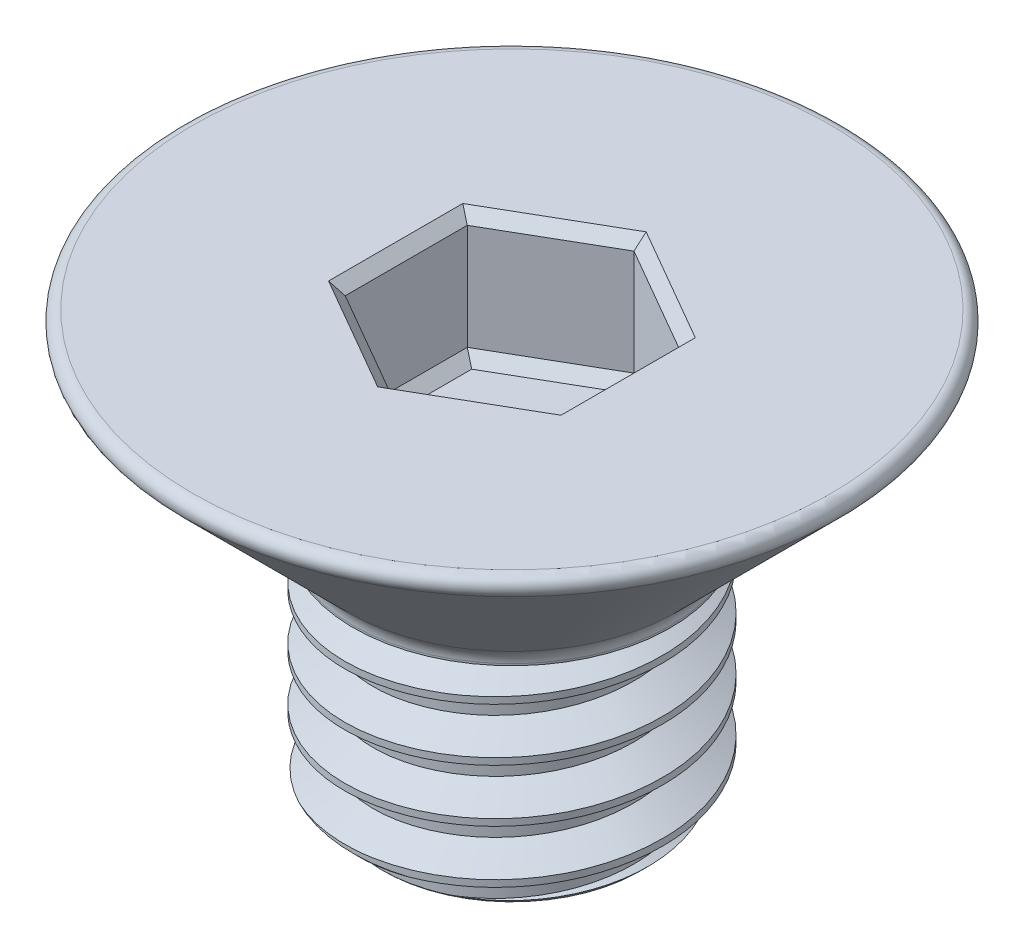
from build123d import *

# Parameters (mm, degrees)
SKETCH1_R           = 1.5
BOSS_EXTRUDE1_DEPTH = 2.14
THREAD1_PITCH       = 0.5
SKETCH5_R           = 1.5
BOSS_EXTRUDE2_DEPTH = 0.1
SKETCH6_R           = 1.5
BOSS_EXTRUDE3_DEPTH = 1.76
BOSS_EXTRUDE3_DRAFT = -45
FILLET1_R           = 0.1
FILLET2_R           = 0.2
CUT_EXTRUDE1_DEPTH  = 1.1
CHAMFER1_SIZE       = 0.1
CUT_EXTRUDE2_DEPTH  = 0.1
CUT_EXTRUDE2_DRAFT  = -45


with BuildPart() as part:
    # Sketch1 → Boss-Extrude1 (new body)
    with BuildSketch(Plane(origin=(0, 0, 0), x_dir=(1, 0, 0), z_dir=(0, 1, 0))):
        with Locations(Location((0, 0, 0), (0, 0, 270))):
            Circle(SKETCH1_R)
    extrude(amount=BOSS_EXTRUDE1_DEPTH)

    # Thread1: the profile of Thread Profile1 profile screwed along a right-hand helix of 6.28 turns, 6 arcs to a turn; built about Z, then put on its axis
    thread1_z = Axis((0, 0, 0), (0, 0, 1))
    thread1_corners = [(1.5003, 0, -0.000173205), (1.5003, 0, 0.437673204), (1.229367063, 0, 0.281249999), (1.229367063, 0, 0.156249999)]
    with BuildLine(mode=Mode.PRIVATE) as thread1_profile:
        Line(thread1_corners[0], thread1_corners[1])
        Line(thread1_corners[1], thread1_corners[2])
        Line(thread1_corners[2], thread1_corners[3])
        Line(thread1_corners[3], thread1_corners[0])
    thread1_cap = Face(thread1_profile.wire())
    thread1_turn_angles = [0, 30, 60, 90, 120, 150, 180, 210, 240, 270, 300, 330, 360]
    thread1_turn_weights = [1, 0.8660254037844387, 1, 0.8660254037844387, 1, 0.8660254037844387, 1, 0.8660254037844387, 1, 0.8660254037844387, 1, 0.8660254037844387, 1]
    thread1_turn_rails = [Edge.make_bspline([Vector(p[0], p[1], 0).rotate(thread1_z, thread1_turn_angles[k]) / thread1_turn_weights[k] + Vector(0, 0, p[2] + THREAD1_PITCH * thread1_turn_angles[k] / 360) for k in range(13)], [0, 0, 0, 1, 1, 2, 2, 3, 3, 4, 4, 5, 5, 6, 6, 6], 2, thread1_turn_weights) for p in thread1_corners]
    thread1_turn_sides = [Face.make_surface_from_curves(thread1_turn_rails[p[0]], thread1_turn_rails[p[1]]) for p in [(0, 1), (1, 2), (2, 3), (3, 0)]]
    thread1_last_angles = [2160, 2190, 2220, 2240.4, 2260.8]
    thread1_last_weights = [1, 0.8660254037844387, 1, 0.9372819894918923, 1]
    thread1_last_rails = [Edge.make_bspline([Vector(p[0], p[1], 0).rotate(thread1_z, thread1_last_angles[k]) / thread1_last_weights[k] + Vector(0, 0, p[2] + THREAD1_PITCH * thread1_last_angles[k] / 360) for k in range(5)], [0, 0, 0, 1, 1, 2, 2, 2], 2, thread1_last_weights) for p in thread1_corners]
    thread1_last_sides = [Face.make_surface_from_curves(thread1_last_rails[p[0]], thread1_last_rails[p[1]]) for p in [(0, 1), (1, 2), (2, 3), (3, 0)]]
    thread1 = Plane(origin=(0, 3.14, 0), x_dir=(-1, 0, 0), z_dir=(0, -1, 0)) * Solid(Shell([*[p.moved(Location((0, 0, THREAD1_PITCH * i))) for i in range(6) for p in thread1_turn_sides], *thread1_last_sides, thread1_cap, thread1_cap.rotate(thread1_z, 2260.8).moved(Location((0, 0, THREAD1_PITCH * 2260.8 / 360)))]))
    add(thread1, mode=Mode.SUBTRACT)

    # Sketch5 → Boss-Extrude2 (add)
    with BuildSketch(Plane(origin=(0, 2.14, 0), x_dir=(1, 0, 0), z_dir=(0, 1, 0))):
        with Locations(Location((0, 0, 0), (0, 0, 79.630240195))):
            Circle(SKETCH5_R)
    extrude(amount=BOSS_EXTRUDE2_DEPTH)


with BuildPart() as boss_extrude3_tool:
    # Sketch6 → Boss-Extrude3 (with draft: the straight prism first)
    with BuildSketch(Plane(origin=(0, 2.24, 0), x_dir=(1, 0, 0), z_dir=(0, 1, 0))):
        with Locations(Location((0, 0, 0), (0, 0, 79.630240195))):
            Circle(SKETCH6_R)
    extrude(amount=BOSS_EXTRUDE3_DEPTH)
    # Boss-Extrude3: the draft: its side faces are tilted about the plane it starts from
    boss_extrude3_sides = [boss_extrude3_tool.faces().sort_by_distance(p)[0] for p in [
        (-0.27, 3.12, 1.475499915),
    ]]
    draft(boss_extrude3_sides, Plane(origin=(0, 2.24, 0), x_dir=(1, 0, 0), z_dir=(0, 1, 0)), BOSS_EXTRUDE3_DRAFT)


with BuildPart() as part_1:
    add(part.part)

    # Boss-Extrude3: add boss_extrude3_tool
    add(boss_extrude3_tool.part)

    # Sketch7 → Cut-Revolve1 (revolve, cut)
    with BuildSketch(Plane.XY, mode=Mode.PRIVATE) as cut_revolve1_sk:
        Polygon((1.51, 0), (1.51, 0.3), (1.21, 0), align=None)
    revolve(cut_revolve1_sk.sketch.rotate(Axis((0, 0, 0), (0, 1, 0)), 135.522486844), axis=Axis((0, 0, 0), (0, 1, 0)), mode=Mode.SUBTRACT)

    # Fillet1
    fillet1_edges = [part_1.edges().sort_by_distance(p)[0] for p in [
        (-0.5868, 4, 3.206753149),
    ]]
    fillet(fillet1_edges, radius=FILLET1_R)

    # Fillet2
    fillet2_edges = [part_1.edges().sort_by_distance(p)[0] for p in [
        (-0.27, 2.24, 1.475499915),
    ]]
    fillet(fillet2_edges, radius=FILLET2_R)

    # Sketch8 → Cut-Extrude1 (cut)
    with BuildSketch(Plane(origin=(0, 4, 0), x_dir=(1, 0, 0), z_dir=(0, 1, 0))):
        Polygon((0, 1.154700538), (-1, 0.577350269), (-1, -0.577350269), (0, -1.154700538), (1, -0.577350269), (1, 0.577350269), align=None)
    extrude(amount=-CUT_EXTRUDE1_DEPTH, mode=Mode.SUBTRACT)

    # Chamfer1
    chamfer1_edges = [part_1.edges().sort_by_distance(p)[0] for p in [
        (0.5, 4, -0.866025404),
        (-0.5, 4, -0.866025404),
        (-1, 4, 0),
        (-0.5, 4, 0.866025404),
        (0.5, 4, 0.866025404),
        (1, 4, 0),
    ]]
    chamfer(chamfer1_edges, length=CHAMFER1_SIZE)


with BuildPart() as cut_extrude2_tool:
    # Sketch9 → Cut-Extrude2 (with draft: the straight prism first)
    with BuildSketch(Plane(origin=(0, 2.9, 0), x_dir=(1, 0, 0), z_dir=(0, 1, 0))):
        Polygon((0, 1.154700538), (-1, 0.577350269), (-1, -0.577350269), (0, -1.154700538), (1, -0.577350269), (1, 0.577350269), align=None)
    extrude(amount=-CUT_EXTRUDE2_DEPTH)
    # Cut-Extrude2: the draft: its side faces are tilted about the plane it starts from
    cut_extrude2_sides = [cut_extrude2_tool.faces().sort_by_distance(p)[0] for p in [
        (-0.5, 2.85, -0.866025404),
        (-1, 2.85, 0),
        (-0.5, 2.85, 0.866025404),
        (0.5, 2.85, 0.866025404),
        (1, 2.85, 0),
        (0.5, 2.85, -0.866025404),
    ]]
    draft(cut_extrude2_sides, Plane(origin=(0, 2.9, 0), x_dir=(1, 0, 0), z_dir=(0, 1, 0)), CUT_EXTRUDE2_DRAFT)


with BuildPart() as part_2:
    add(part_1.part)

    # Cut-Extrude2: cut by cut_extrude2_tool
    add(cut_extrude2_tool.part, mode=Mode.SUBTRACT)


solid = part_2.part
